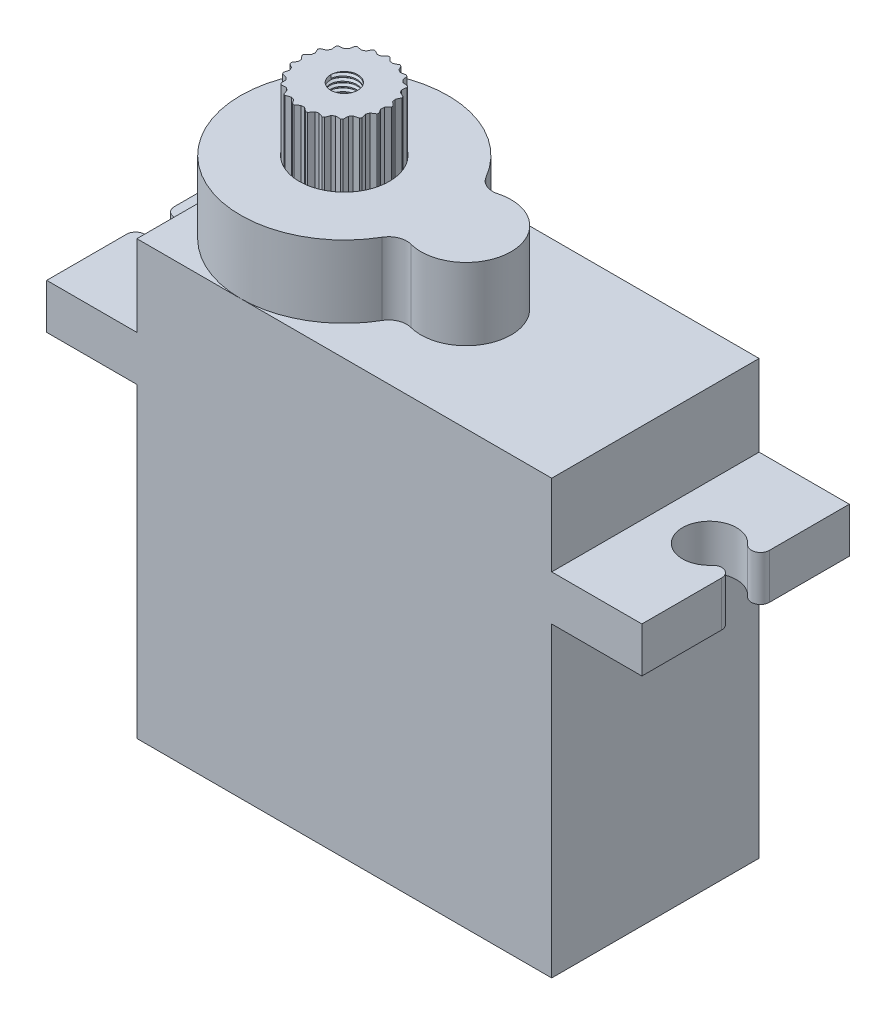
from build123d import *
from build123d.topology import SkipClean

# Parameters (mm, degrees)
BOSS_EXTRUDE1_DEPTH = 11.5
CUT_EXTRUDE1_DEPTH  = 12
CUT_EXTRUDE2_DEPTH  = 12
BOSS_EXTRUDE2_DEPTH = 4
SKETCH5_R           = 2.5
CUT_EXTRUDE3_DEPTH  = 6
BOSS_EXTRUDE4_DEPTH = 9.5
SKETCH11_R          = 0.75
CUT_EXTRUDE6_DEPTH  = 6
THREAD2_PITCH       = 0.25


with BuildPart() as part:
    # Sketch1 → Boss-Extrude1 (new body)
    with BuildSketch(Plane.XY):
        Polygon((23, 17), (28, 17), (28, 19.5), (23, 19.5), (23, 24), (0, 24), (0, 19.5), (-5, 19.5), (-5, 17), (0, 17), (0, 0), (23, 0), align=None)
    extrude(amount=BOSS_EXTRUDE1_DEPTH)

    # Sketch2 → Cut-Extrude1 (cut)
    with BuildSketch(Plane(origin=(0, 19.5, 0), x_dir=(1, 0, 0), z_dir=(0, 1, 0))):
        with BuildLine():
            Line((-5, -4.427124344), (-5, -7.072875656))
            ThreePointArc((-5, -7.072875656), (-4.676776695, -6.605168482), (-4.125, -6.742156742))
            ThreePointArc((-4.125, -6.742156742), (-1.5, -5.75), (-4.125, -4.757843258))
            ThreePointArc((-4.125, -4.757843258), (-4.676776695, -4.894831518), (-5, -4.427124344))
        make_face()
    extrude(amount=-CUT_EXTRUDE1_DEPTH, mode=Mode.SUBTRACT)

    # Sketch3 → Cut-Extrude2 (cut)
    with BuildSketch(Plane(origin=(0, 19.5, 0), x_dir=(1, 0, 0), z_dir=(0, 1, 0))):
        with BuildLine():
            Line((28, -4.427124344), (28, -7.072875656))
            ThreePointArc((28, -7.072875656), (27.676776695, -6.605168482), (27.125, -6.742156742))
            ThreePointArc((27.125, -6.742156742), (24.5, -5.75), (27.125, -4.757843258))
            ThreePointArc((27.125, -4.757843258), (27.676776695, -4.894831518), (28, -4.427124344))
        make_face()
    extrude(amount=-CUT_EXTRUDE2_DEPTH, mode=Mode.SUBTRACT)

    # Sketch4 → Boss-Extrude2 (add)
    with BuildSketch(Plane(origin=(0, 24, 0), x_dir=(1, 0, 0), z_dir=(0, 1, 0))):
        with BuildLine():
            ThreePointArc((10.72702332, -2.870462038), (0, -5.75), (10.72702332, -8.629537962))
            ThreePointArc((10.72702332, -8.629537962), (11.210540866, -8.206186232), (11.851851852, -8.164519409))
            ThreePointArc((11.851851852, -8.164519409), (15, -5.75), (11.851851852, -3.335480591))
            ThreePointArc((11.851851852, -3.335480591), (11.210540866, -3.293813768), (10.72702332, -2.870462038))
        make_face()
    extrude(amount=BOSS_EXTRUDE2_DEPTH)

    # Sketch5 → Cut-Extrude3 (cut)
    with BuildSketch(Plane(origin=(0, 28, 0), x_dir=(1, 0, 0), z_dir=(0, 1, 0))):
        with Locations(Location((5.75, -5.75, 0), (0, 0, 270))):
            Circle(SKETCH5_R)
    extrude(amount=-CUT_EXTRUDE3_DEPTH, mode=Mode.SUBTRACT)

    # Sketch6 → Boss-Extrude4 (add)
    with BuildSketch(Plane(origin=(0, 22, 0), x_dir=(1, 0, 0), z_dir=(0, 1, 0))):
        with BuildLine():
            Line((5.75, -3.262492511), (5.8, -3.262492511))
            Line((5.8, -3.262492511), (6, -3.463627327))
            ThreePointArc((6, -3.463627327), (6.092797212, -3.4756891), (6.185026975, -3.491515656))
            Line((6.185026975, -3.491515656), (6.435427063, -3.358267731))
            Line((6.435427063, -3.358267731), (6.483205704, -3.37300549))
            Line((6.483205704, -3.37300549), (6.530984344, -3.387743248))
            Line((6.530984344, -3.387743248), (6.662813377, -3.638893243))
            ThreePointArc((6.662813377, -3.638893243), (6.7479326, -3.677771604), (6.831399893, -3.72008023))
            Line((6.831399893, -3.72008023), (7.109950924, -3.666558858))
            Line((7.109950924, -3.666558858), (7.151262863, -3.694724861))
            Line((7.151262863, -3.694724861), (7.192574802, -3.722890864))
            Line((7.192574802, -3.722890864), (7.244519281, -4.00174026))
            ThreePointArc((7.244519281, -4.00174026), (7.314397297, -4.063980695), (7.381685686, -4.129012084))
            Line((7.381685686, -4.129012084), (7.663637178, -4.159972875))
            Line((7.663637178, -4.159972875), (7.694811668, -4.199064449))
            Line((7.694811668, -4.199064449), (7.725986158, -4.238156023))
            Line((7.725986158, -4.238156023), (7.693430587, -4.519927826))
            ThreePointArc((7.693430587, -4.519927826), (7.741858429, -4.6), (7.786989045, -4.681975828))
            Line((7.786989045, -4.681975828), (8.04728837, -4.794667778))
            Line((8.04728837, -4.794667778), (8.065555421, -4.841211466))
            Line((8.065555421, -4.841211466), (8.083822472, -4.887755153))
            Line((8.083822472, -4.887755153), (7.969659557, -5.147412703))
            ThreePointArc((7.969659557, -5.147412703), (7.992334198, -5.238201852), (8.011296988, -5.329838207))
            Line((8.011296988, -5.329838207), (8.226815409, -5.514248143))
            Line((8.226815409, -5.514248143), (8.230551913, -5.564108333))
            Line((8.230551913, -5.564108333), (8.234288418, -5.613968522))
            Line((8.234288418, -5.613968522), (8.048662035, -5.828440105))
            ThreePointArc((8.048662035, -5.828440105), (8.043568734, -5.921879215), (8.03467877, -6.015033805))
            Line((8.03467877, -6.015033805), (8.186266529, -6.254776094))
            Line((8.186266529, -6.254776094), (8.175140483, -6.30352249))
            Line((8.175140483, -6.30352249), (8.164014436, -6.352268885))
            Line((8.164014436, -6.352268885), (7.923418303, -6.502497761))
            ThreePointArc((7.923418303, -6.502497761), (7.891009622, -6.590284356), (7.855056817, -6.676679986))
            Line((7.855056817, -6.676679986), (7.929244677, -6.950452474))
            Line((7.929244677, -6.950452474), (7.904244677, -6.993753744))
            Line((7.904244677, -6.993753744), (7.879244677, -7.037055015))
            Line((7.879244677, -7.037055015), (7.605056817, -7.109692687))
            ThreePointArc((7.605056817, -7.109692687), (7.54821241, -7.184026544), (7.488391329, -7.255986583))
            Line((7.488391329, -7.255986583), (7.478587372, -7.539463384))
            Line((7.478587372, -7.539463384), (7.441934779, -7.573472021))
            Line((7.441934779, -7.573472021), (7.405282185, -7.607480658))
            Line((7.405282185, -7.607480658), (7.121865393, -7.596072952))
            ThreePointArc((7.121865393, -7.596072952), (7.045636134, -7.650349181), (6.967262141, -7.701479664))
            Line((6.967262141, -7.701479664), (6.874337494, -7.969472619))
            Line((6.874337494, -7.969472619), (6.82928905, -7.991166806))
            Line((6.82928905, -7.991166806), (6.784240607, -8.012860993))
            Line((6.784240607, -8.012860993), (6.516777707, -7.918421534))
            ThreePointArc((6.516777707, -7.918421534), (6.427936901, -7.947817453), (6.337973871, -7.973575213))
            Line((6.337973871, -7.973575213), (6.170185295, -8.202271972))
            Line((6.170185295, -8.202271972), (6.120743753, -8.209724085))
            Line((6.120743753, -8.209724085), (6.071302212, -8.217176199))
            Line((6.071302212, -8.217176199), (5.843558458, -8.048096346))
            ThreePointArc((5.843558458, -8.048096346), (5.75, -8.05), (5.656441542, -8.048096346))
            Line((5.656441542, -8.048096346), (5.428697788, -8.217176199))
            Line((5.428697788, -8.217176199), (5.379256247, -8.209724085))
            Line((5.379256247, -8.209724085), (5.329814705, -8.202271972))
            Line((5.329814705, -8.202271972), (5.162026129, -7.973575213))
            ThreePointArc((5.162026129, -7.973575213), (5.072063099, -7.947817453), (4.983222293, -7.918421534))
            Line((4.983222293, -7.918421534), (4.715759393, -8.012860993))
            Line((4.715759393, -8.012860993), (4.67071095, -7.991166806))
            Line((4.67071095, -7.991166806), (4.625662506, -7.969472619))
            Line((4.625662506, -7.969472619), (4.532737859, -7.701479664))
            ThreePointArc((4.532737859, -7.701479664), (4.454363866, -7.650349181), (4.378134607, -7.596072952))
            Line((4.378134607, -7.596072952), (4.094717815, -7.607480658))
            Line((4.094717815, -7.607480658), (4.058065221, -7.573472021))
            Line((4.058065221, -7.573472021), (4.021412628, -7.539463384))
            Line((4.021412628, -7.539463384), (4.011608671, -7.255986583))
            ThreePointArc((4.011608671, -7.255986583), (3.95178759, -7.184026544), (3.894943183, -7.109692687))
            Line((3.894943183, -7.109692687), (3.620755323, -7.037055015))
            Line((3.620755323, -7.037055015), (3.595755323, -6.993753744))
            Line((3.595755323, -6.993753744), (3.570755323, -6.950452474))
            Line((3.570755323, -6.950452474), (3.644943183, -6.676679986))
            ThreePointArc((3.644943183, -6.676679986), (3.608990378, -6.590284356), (3.576581697, -6.502497761))
            Line((3.576581697, -6.502497761), (3.335985564, -6.352268885))
            Line((3.335985564, -6.352268885), (3.324859517, -6.30352249))
            Line((3.324859517, -6.30352249), (3.313733471, -6.254776094))
            Line((3.313733471, -6.254776094), (3.46532123, -6.015033805))
            ThreePointArc((3.46532123, -6.015033805), (3.456431266, -5.921879215), (3.451337965, -5.828440105))
            Line((3.451337965, -5.828440105), (3.265711582, -5.613968522))
            Line((3.265711582, -5.613968522), (3.269448087, -5.564108333))
            Line((3.269448087, -5.564108333), (3.273184591, -5.514248143))
            Line((3.273184591, -5.514248143), (3.488703012, -5.329838207))
            ThreePointArc((3.488703012, -5.329838207), (3.507665802, -5.238201852), (3.530340443, -5.147412703))
            Line((3.530340443, -5.147412703), (3.416177528, -4.887755153))
            Line((3.416177528, -4.887755153), (3.434444579, -4.841211466))
            Line((3.434444579, -4.841211466), (3.45271163, -4.794667778))
            Line((3.45271163, -4.794667778), (3.713010955, -4.681975828))
            ThreePointArc((3.713010955, -4.681975828), (3.758141571, -4.6), (3.806569413, -4.519927826))
            Line((3.806569413, -4.519927826), (3.774013842, -4.238156023))
            Line((3.774013842, -4.238156023), (3.805188332, -4.199064449))
            Line((3.805188332, -4.199064449), (3.836362822, -4.159972875))
            Line((3.836362822, -4.159972875), (4.118314314, -4.129012084))
            ThreePointArc((4.118314314, -4.129012084), (4.185602703, -4.063980695), (4.255480719, -4.00174026))
            Line((4.255480719, -4.00174026), (4.307425198, -3.722890864))
            Line((4.307425198, -3.722890864), (4.348737137, -3.694724861))
            Line((4.348737137, -3.694724861), (4.390049076, -3.666558858))
            Line((4.390049076, -3.666558858), (4.668600107, -3.72008023))
            ThreePointArc((4.668600107, -3.72008023), (4.7520674, -3.677771604), (4.837186623, -3.638893243))
            Line((4.837186623, -3.638893243), (4.969015656, -3.387743248))
            Line((4.969015656, -3.387743248), (5.016794296, -3.37300549))
            Line((5.016794296, -3.37300549), (5.064572937, -3.358267731))
            Line((5.064572937, -3.358267731), (5.314973025, -3.491515656))
            ThreePointArc((5.314973025, -3.491515656), (5.407202788, -3.4756891), (5.5, -3.463627327))
            Line((5.5, -3.463627327), (5.7, -3.262492511))
            Line((5.7, -3.262492511), (5.75, -3.262492511))
        make_face()
    extrude(amount=BOSS_EXTRUDE4_DEPTH)

    # Sketch11 → Cut-Extrude6 (cut)
    with BuildSketch(Plane(origin=(0, 31.5, 0), x_dir=(1, 0, 0), z_dir=(0, 1, 0))):
        with Locations(Location((5.75, -5.75, 0), (0, 0, 270))):
            Circle(SKETCH11_R)
    extrude(amount=-CUT_EXTRUDE6_DEPTH, mode=Mode.SUBTRACT)

    # Thread2: the profile of Thread Profile2 profile screwed along a right-hand helix of 24 turns, 6 arcs to a turn; built about Z, then put on its axis
    with SkipClean():  # the faces are left unmerged after this step: merging them gives an invalid solid
        thread2_z = Axis((0, 0, 0), (0, 0, 1))
        thread2_corners = [(0.7497, 0, -0.000173205), (0.885316469, 0, 0.078125), (0.885316469, 0, 0.109375), (0.7497, 0, 0.187673204)]
        with BuildLine(mode=Mode.PRIVATE) as thread2_profile:
            Line(thread2_corners[0], thread2_corners[1])
            Line(thread2_corners[1], thread2_corners[2])
            Line(thread2_corners[2], thread2_corners[3])
            Line(thread2_corners[3], thread2_corners[0])
        thread2_cap = Face(thread2_profile.wire())
        thread2_turn_angles = [0, 30, 60, 90, 120, 150, 180, 210, 240, 270, 300, 330, 360]
        thread2_turn_weights = [1, 0.8660254037844387, 1, 0.8660254037844387, 1, 0.8660254037844387, 1, 0.8660254037844387, 1, 0.8660254037844387, 1, 0.8660254037844387, 1]
        thread2_turn_rails = [Edge.make_bspline([Vector(p[0], p[1], 0).rotate(thread2_z, thread2_turn_angles[k]) / thread2_turn_weights[k] + Vector(0, 0, p[2] + THREAD2_PITCH * thread2_turn_angles[k] / 360) for k in range(13)], [0, 0, 0, 1, 1, 2, 2, 3, 3, 4, 4, 5, 5, 6, 6, 6], 2, thread2_turn_weights) for p in thread2_corners]
        thread2_turn_sides = [Face.make_surface_from_curves(thread2_turn_rails[p[0]], thread2_turn_rails[p[1]]) for p in [(0, 1), (1, 2), (2, 3), (3, 0)]]
        thread2 = Plane(origin=(5.75, 31.5, 5.75), x_dir=(-1, 0, 0), z_dir=(0, -1, 0)) * Solid(Shell([*[p.moved(Location((0, 0, THREAD2_PITCH * i))) for i in range(24) for p in thread2_turn_sides], thread2_cap, thread2_cap.rotate(thread2_z, 8640).moved(Location((0, 0, THREAD2_PITCH * 8640 / 360)))]))
        add(thread2, mode=Mode.SUBTRACT)


solid = part.part
